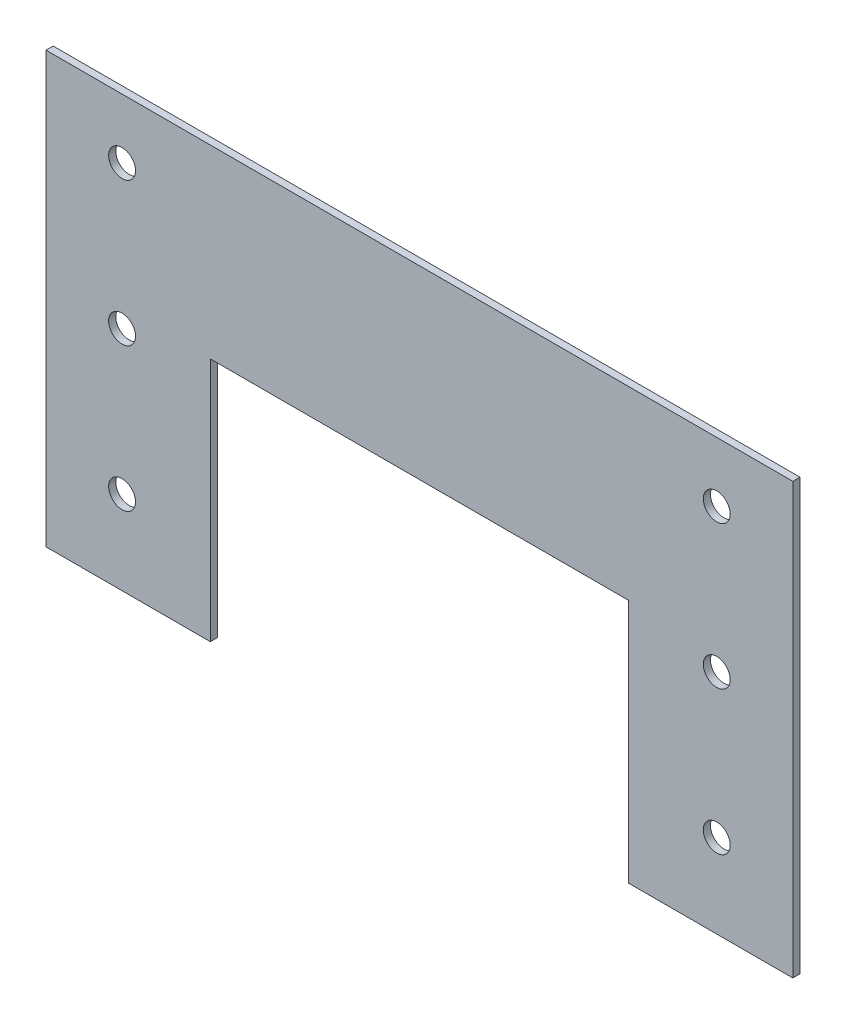
from build123d import *

# Parameters (mm, degrees)
SKETCH_1_R             = 2.25
SM_BASE_FLANGE_1_DEPTH = 1.2


# Sheet-metal steps are written as plain solids
with BuildPart() as part:
    # Sketch 1 → Базовая кромка1 (new body)
    with BuildSketch(Plane.XY):
        Polygon((97.5, 0), (125, 0), (125, 72), (0, 72), (0, 0), (27.5, 0), (27.5, 41), (97.5, 41), align=None)
        with Locations((112.2683, 62)):
            Circle(SKETCH_1_R, mode=Mode.SUBTRACT)
        with Locations((112.2683, 38)):
            Circle(SKETCH_1_R, mode=Mode.SUBTRACT)
        with Locations((112.2683, 14)):
            Circle(SKETCH_1_R, mode=Mode.SUBTRACT)
        with Locations((12.7317, 62)):
            Circle(SKETCH_1_R, mode=Mode.SUBTRACT)
        with Locations((12.7317, 38)):
            Circle(SKETCH_1_R, mode=Mode.SUBTRACT)
        with Locations((12.7317, 14)):
            Circle(SKETCH_1_R, mode=Mode.SUBTRACT)
    extrude(amount=-SM_BASE_FLANGE_1_DEPTH)


solid = part.part
